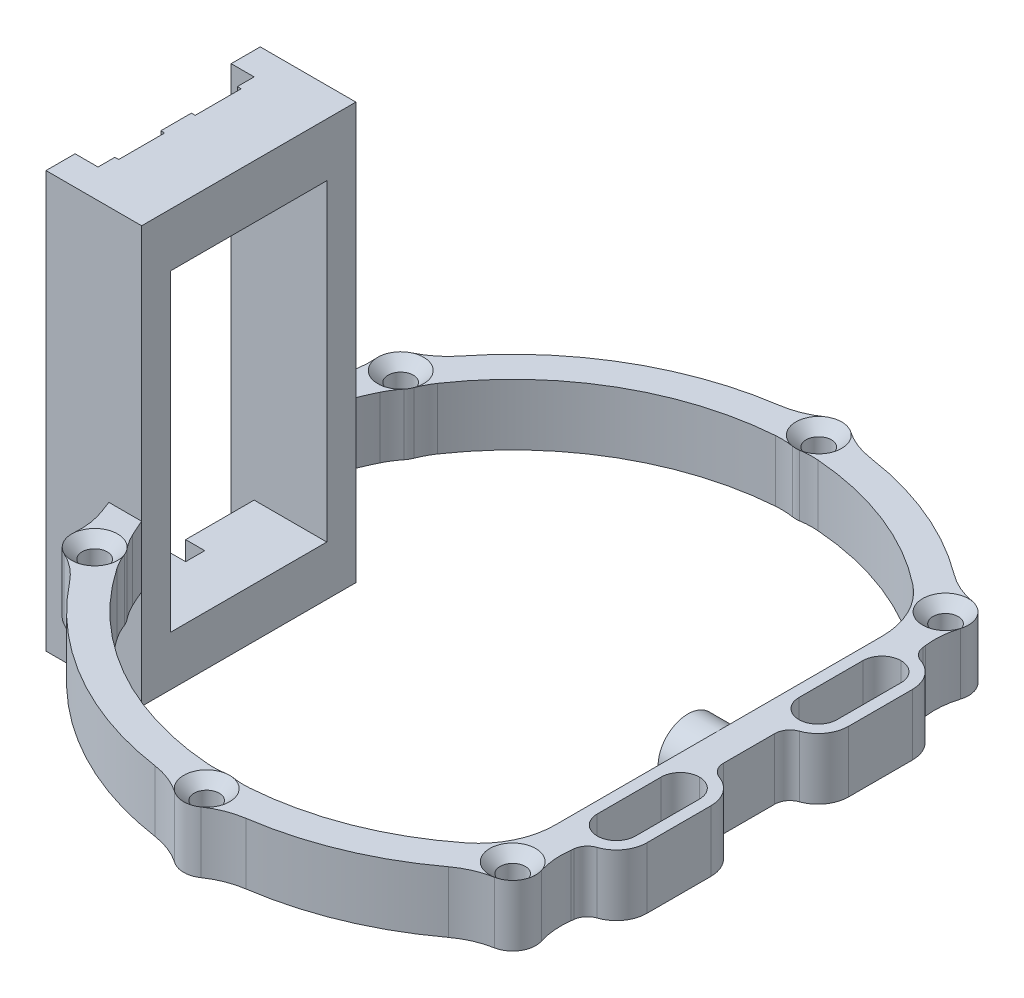
from build123d import *

# Parameters (mm, degrees)
SKETCH6_W                 = 28
SKETCH6_H                 = 54
SKETCH6_R                 = 2.125
SKETCH6_W_2               = 20.4
SKETCH6_H_2               = 40.4
BOSS_EXTRUDE1_DEPTH       = 4
SKETCH7_W                 = 28
SKETCH7_H                 = 54
SKETCH7_W_2               = 20.4
SKETCH7_H_2               = 40.9
BOSS_EXTRUDE2_DEPTH       = 5.5
SKETCH8_W                 = 3.8
SKETCH8_H                 = 6.8
BOSS_EXTRUDE3_DEPTH       = 3
CUT_EXTRUDE1_DEPTH        = 41.912253666
CUT_EXTRUDE1_DEPTH_BACK   = 0.5
SKETCH12_W                = 2.5
SKETCH12_H                = 53.4
CUT_EXTRUDE2_DEPTH        = 2.5
BOSS_EXTRUDE5_DEPTH       = 4
BOSS_EXTRUDE5_DEPTH_BACK  = 4
SKETCH13_R                = 41.232378382
SKETCH13_R_2              = 37.232378382
BOSS_EXTRUDE6_DEPTH       = 0.2
BOSS_EXTRUDE7_DEPTH       = 0.2
BOSS_EXTRUDE8_DEPTH       = 4
BOSS_EXTRUDE8_DEPTH_BACK  = 4
SKETCH17_R                = 3.9
BOSS_EXTRUDE9_DEPTH       = 4
SKETCH18_W                = 48.076230271
SKETCH18_H                = 104.436782707
CUT_EXTRUDE3_DEPTH        = 71.908472886
FILLET1_R                 = 10
FILLET2_R                 = 14
SKETCH19_W                = 20.4
SKETCH19_H                = 40.9
CUT_EXTRUDE4_DEPTH        = 86.905596599
BOSS_EXTRUDE10_DEPTH      = 4
BOSS_EXTRUDE10_DEPTH_BACK = 4
SKETCH20_R                = 3
SKETCH20_R_2              = 1.65
CUT_EXTRUDE5_DEPTH        = 72.950694924
CUT_EXTRUDE5_DEPTH_BACK   = 72.950694924
FILLET5_R                 = 10
CHAMFER1_SIZE             = 1.35
SKETCH22_W                = 4
SKETCH22_H                = 16.35397931
BOSS_EXTRUDE11_DEPTH      = 8
SKETCH23_W                = 5
SKETCH23_H                = 13.35397931
CUT_EXTRUDE6_DEPTH        = 10
FILLET6_R                 = 2.5
FILLET7_R                 = 4
FILLET8_R                 = 2


with BuildPart() as part:
    # Sketch6 → Boss-Extrude1 (new body)
    with BuildSketch(Plane(origin=(-44, 0, 0), x_dir=(0, 0, -1), z_dir=(1, 0, 0))):
        with Locations((0, 10.25)):
            Rectangle(SKETCH6_W, SKETCH6_H)
        with Locations((-5, 34.25)):
            Circle(SKETCH6_R, mode=Mode.SUBTRACT)
        with Locations((5, 34.25)):
            Circle(SKETCH6_R, mode=Mode.SUBTRACT)
        with Locations((-5, -13.75)):
            Circle(SKETCH6_R, mode=Mode.SUBTRACT)
        with Locations((5, -13.75)):
            Circle(SKETCH6_R, mode=Mode.SUBTRACT)
        with Locations((0, 10.25)):
            Rectangle(SKETCH6_W_2, SKETCH6_H_2, mode=Mode.SUBTRACT)
    extrude(amount=BOSS_EXTRUDE1_DEPTH)

    # Sketch7 → Boss-Extrude2 (add)
    with BuildSketch(Plane(origin=(-40, 0, 0), x_dir=(0, 0, -1), z_dir=(1, 0, 0))):
        with Locations((0, 10.25)):
            Rectangle(SKETCH7_W, SKETCH7_H)
        with Locations((0, 10)):
            Rectangle(SKETCH7_W_2, SKETCH7_H_2, mode=Mode.SUBTRACT)
    extrude(amount=BOSS_EXTRUDE2_DEPTH)

    # Sketch8 → Boss-Extrude3 (add)
    with BuildSketch(Plane.ZY.offset(44)):
        with Locations((12.1, 33.85)):
            Rectangle(SKETCH8_W, SKETCH8_H)
        Polygon((14, 30.45), (10.2, 30.45), (10.2, -9.95), (10.2, -16.75), (14, -16.75), align=None)
        Polygon((-10.2, 37.25), (-14, 37.25), (-14, -9.95), (-10.2, -9.95), (-10.2, 30.45), align=None)
        with Locations((-12.1, -13.35)):
            Rectangle(SKETCH8_W, SKETCH8_H)
    extrude(amount=BOSS_EXTRUDE3_DEPTH)

    # Sketch9 → Cut-Extrude1 (cut, two sides: drawn at the far end of the back side and taken through both)
    with BuildSketch(Plane.ZY.offset(44).offset(-CUT_EXTRUDE1_DEPTH_BACK)):
        with BuildLine():
            Line((8, -16.75), (8, -13.75))
            ThreePointArc((8, -13.75), (7.121320344, -15.871320344), (5, -16.75))
            Line((5, -16.75), (8, -16.75))
        make_face()
        with BuildLine():
            ThreePointArc((8, -13.75), (5, -10.75), (2, -13.75))
            Line((2, -13.75), (8, -13.75))
        make_face()
        with BuildLine():
            Line((8, -13.75), (2, -13.75))
            ThreePointArc((2, -13.75), (2.878679656, -15.871320344), (5, -16.75))
            ThreePointArc((5, -16.75), (7.121320344, -15.871320344), (8, -13.75))
        make_face()
        with BuildLine():
            ThreePointArc((5, -16.75), (2.878679656, -15.871320344), (2, -13.75))
            Line((2, -13.75), (2, -16.75))
            Line((2, -16.75), (5, -16.75))
        make_face()
        with BuildLine():
            Line((-2, -16.75), (-2, -13.75))
            ThreePointArc((-2, -13.75), (-2.878679656, -15.871320344), (-5, -16.75))
            Line((-5, -16.75), (-2, -16.75))
        make_face()
        with BuildLine():
            ThreePointArc((-2, -13.75), (-5, -10.75), (-8, -13.75))
            Line((-8, -13.75), (-2, -13.75))
        make_face()
        with BuildLine():
            Line((-2, -13.75), (-8, -13.75))
            ThreePointArc((-8, -13.75), (-7.121320344, -15.871320344), (-5, -16.75))
            ThreePointArc((-5, -16.75), (-2.878679656, -15.871320344), (-2, -13.75))
        make_face()
        with BuildLine():
            ThreePointArc((-5, -16.75), (-7.121320344, -15.871320344), (-8, -13.75))
            Line((-8, -13.75), (-8, -16.75))
            Line((-8, -16.75), (-5, -16.75))
        make_face()
        with BuildLine():
            ThreePointArc((-7.125, 34.25), (-5, 36.375), (-2.875, 34.25))
            Line((-2.875, 34.25), (-2, 34.25))
            ThreePointArc((-2, 34.25), (-2.878679652, 36.371320339), (-4.999999988, 37.25))
            ThreePointArc((-4.999999988, 37.25), (-7.121320339, 36.371320348), (-8, 34.25))
            Line((-8, 34.25), (-7.125, 34.25))
        make_face()
        with BuildLine():
            Line((-2, 34.25), (-2.875, 34.25))
            ThreePointArc((-2.875, 34.25), (-5, 32.125), (-7.125, 34.25))
            Line((-7.125, 34.25), (-8, 34.25))
            ThreePointArc((-8, 34.25), (-5, 31.25), (-2, 34.25))
        make_face()
        with BuildLine():
            ThreePointArc((-7.125, 34.25), (-5, 32.125), (-2.875, 34.25))
            Line((-2.875, 34.25), (-7.125, 34.25))
        make_face()
        with BuildLine():
            Line((-7.125, 34.25), (-2.875, 34.25))
            ThreePointArc((-2.875, 34.25), (-5, 36.375), (-7.125, 34.25))
        make_face()
        with BuildLine():
            ThreePointArc((-4.999999988, 37.25), (-2.878679652, 36.371320339), (-2, 34.25))
            Line((-2, 34.25), (-2, 37.25))
            Line((-2, 37.25), (-4.999999988, 37.25))
        make_face()
        with BuildLine():
            Line((-8, 37.25), (-8, 34.25))
            ThreePointArc((-8, 34.25), (-7.121320339, 36.371320348), (-4.999999988, 37.25))
            Line((-4.999999988, 37.25), (-8, 37.25))
        make_face()
        with BuildLine():
            Line((8, 37.25), (5, 37.25))
            ThreePointArc((5, 37.25), (7.121320344, 36.371320344), (8, 34.25))
            Line((8, 34.25), (8, 37.25))
        make_face()
        with BuildLine():
            ThreePointArc((5, 37.25), (2.878679656, 36.371320344), (2, 34.25))
            Line((2, 34.25), (2.875, 34.25))
            ThreePointArc((2.875, 34.25), (5, 36.375), (7.125, 34.25))
            Line((7.125, 34.25), (8, 34.25))
            ThreePointArc((8, 34.25), (7.121320344, 36.371320344), (5, 37.25))
        make_face()
        with BuildLine():
            Line((2.875, 34.25), (2, 34.25))
            ThreePointArc((2, 34.25), (5, 31.25), (8, 34.25))
            Line((8, 34.25), (7.125, 34.25))
            ThreePointArc((7.125, 34.25), (5, 32.125), (2.875, 34.25))
        make_face()
        with BuildLine():
            Line((5, 37.25), (2, 37.25))
            Line((2, 37.25), (2, 34.25))
            ThreePointArc((2, 34.25), (2.878679656, 36.371320344), (5, 37.25))
        make_face()
        with BuildLine():
            ThreePointArc((7.125, 34.25), (5, 36.375), (2.875, 34.25))
            Line((2.875, 34.25), (7.125, 34.25))
        make_face()
        with BuildLine():
            Line((7.125, 34.25), (2.875, 34.25))
            ThreePointArc((2.875, 34.25), (5, 32.125), (7.125, 34.25))
        make_face()
    extrude(amount=CUT_EXTRUDE1_DEPTH + CUT_EXTRUDE1_DEPTH_BACK, mode=Mode.SUBTRACT)

    # Sketch12 → Cut-Extrude2 (cut)
    with BuildSketch(Plane.ZY.offset(44)):
        with Locations((0, 10.25)):
            Rectangle(SKETCH12_W, SKETCH12_H)
    extrude(amount=-CUT_EXTRUDE2_DEPTH, mode=Mode.SUBTRACT)

    # Sketch13 → Boss-Extrude5 (add, two sides: drawn at the far end of the back side and taken through both)
    with BuildSketch(Plane(origin=(0, 0, 0), x_dir=(1, 0, 0), z_dir=(0, 1, 0)).offset(-BOSS_EXTRUDE5_DEPTH_BACK)):
        Circle(SKETCH13_R)
        Circle(SKETCH13_R_2, mode=Mode.SUBTRACT)
    extrude(amount=BOSS_EXTRUDE5_DEPTH + BOSS_EXTRUDE5_DEPTH_BACK)

    # Sketch14 → Boss-Extrude6 (add)
    with BuildSketch(Plane(origin=(0, 37.25, 0), x_dir=(1, 0, 0), z_dir=(0, 1, 0))):
        Polygon((-44, 2), (-44, -2), (-43.5, -2), (-43.5, -8), (-44, -8), (-44, -10.2), (-47, -10.2), (-47, -14), (-34.5, -14), (-34.5, 14), (-47, 14), (-47, 10.2), (-44, 10.2), (-44, 8), (-43.5, 8), (-43.5, 2), align=None)
    extrude(amount=BOSS_EXTRUDE6_DEPTH)

    # Sketch15 → Boss-Extrude7 (add)
    with BuildSketch(Plane.XZ.offset(16.75)):
        Polygon((-43.5, 2), (-44, 2), (-44, -2), (-43.5, -2), (-43.5, -8), (-44, -8), (-44, -10.2), (-47, -10.2), (-47, -14), (-34.5, -14), (-34.5, 14), (-47, 14), (-47, 10.2), (-44, 10.2), (-44, 8), (-43.5, 8), align=None)
    extrude(amount=BOSS_EXTRUDE7_DEPTH)

    # Sketch16 → Boss-Extrude8 (add, two sides: drawn at the far end of the back side and taken through both)
    with BuildSketch(Plane(origin=(0, 0, 0), x_dir=(1, 0, 0), z_dir=(0, 1, 0)).offset(-BOSS_EXTRUDE8_DEPTH_BACK)):
        with BuildLine():
            ThreePointArc((30.9, 20.771133816), (29.006669365, 23.342303492), (26.9, 25.741794809))
            Line((26.9, 25.741794809), (26.9, -25.741794809))
            ThreePointArc((26.9, -25.741794809), (29.006669365, -23.342303492), (30.9, -20.771133816))
            Line((30.9, -20.771133816), (30.9, 20.771133816))
        make_face()
    extrude(amount=BOSS_EXTRUDE8_DEPTH + BOSS_EXTRUDE8_DEPTH_BACK)

    # Sketch17 → Boss-Extrude9 (add)
    with BuildSketch(Plane.ZY.offset(-26.9)):
        Circle(SKETCH17_R)
    extrude(amount=BOSS_EXTRUDE9_DEPTH)

    # Sketch18 → Cut-Extrude3 (cut, through all)
    with BuildSketch(Plane(origin=(0, 4, 0), x_dir=(1, 0, 0), z_dir=(0, 1, 0))):
        with Locations((54.938115136, -6.824380144)):
            Rectangle(SKETCH18_W, SKETCH18_H)
    extrude(amount=-CUT_EXTRUDE3_DEPTH, mode=Mode.SUBTRACT)

    # Fillet1
    fillet1_edges = [part.edges().sort_by_distance(p)[0] for p in [
        (26.9, 0, -25.741794809),
        (26.9, 0, 25.741794809),
    ]]
    fillet(fillet1_edges, radius=FILLET1_R)

    # Fillet2
    fillet2_edges = [part.edges().sort_by_distance(p)[0] for p in [
        (30.9, 0, -27.30016533),
        (30.9, 0, 27.30016533),
    ]]
    fillet(fillet2_edges, radius=FILLET2_R)

    # Sketch19 → Cut-Extrude4 (cut, through all)
    with BuildSketch(Plane(origin=(-34.5, 0, 0), x_dir=(0, 0, -1), z_dir=(1, 0, 0))):
        with Locations((0, 10)):
            Rectangle(SKETCH19_W, SKETCH19_H)
    extrude(amount=-CUT_EXTRUDE4_DEPTH, mode=Mode.SUBTRACT)

    # Sketch20 → Boss-Extrude10 (add, two sides: drawn at the far end of the back side and taken through both)
    # profile 1 of 6: a face of its own
    with BuildSketch(Plane(origin=(0, 0, 0), x_dir=(1, 0, 0), z_dir=(0, 1, 0)).offset(-BOSS_EXTRUDE10_DEPTH_BACK)):
        with Locations((28.284271247, 28.284271247)):
            Circle(SKETCH20_R)
        with Locations((28.284271247, 28.284271247)):
            Circle(SKETCH20_R_2, mode=Mode.SUBTRACT)
    # profile 2 of 6: a face of its own
    with BuildSketch(Plane(origin=(0, 0, 0), x_dir=(1, 0, 0), z_dir=(0, 1, 0)).offset(-BOSS_EXTRUDE10_DEPTH_BACK)):
        with Locations((28.284271247, -28.284271247)):
            Circle(SKETCH20_R)
        with Locations((28.284271247, -28.284271247)):
            Circle(SKETCH20_R_2, mode=Mode.SUBTRACT)
    # profile 3 of 6: a face of its own
    with BuildSketch(Plane(origin=(0, 0, 0), x_dir=(1, 0, 0), z_dir=(0, 1, 0)).offset(-BOSS_EXTRUDE10_DEPTH_BACK)):
        with Locations((0, -40)):
            Circle(SKETCH20_R)
        with Locations((0, -40)):
            Circle(SKETCH20_R_2, mode=Mode.SUBTRACT)
    # profile 4 of 6: a face of its own
    with BuildSketch(Plane(origin=(0, 0, 0), x_dir=(1, 0, 0), z_dir=(0, 1, 0)).offset(-BOSS_EXTRUDE10_DEPTH_BACK)):
        with Locations((0, 40)):
            Circle(SKETCH20_R)
        with Locations((0, 40)):
            Circle(SKETCH20_R_2, mode=Mode.SUBTRACT)
    # profile 5 of 6: a face of its own
    with BuildSketch(Plane(origin=(0, 0, 0), x_dir=(1, 0, 0), z_dir=(0, 1, 0)).offset(-BOSS_EXTRUDE10_DEPTH_BACK)):
        with Locations((-34.641016151, 20)):
            Circle(SKETCH20_R)
        with Locations((-34.641016151, 20)):
            Circle(SKETCH20_R_2, mode=Mode.SUBTRACT)
    # profile 6 of 6: a face of its own
    with BuildSketch(Plane(origin=(0, 0, 0), x_dir=(1, 0, 0), z_dir=(0, 1, 0)).offset(-BOSS_EXTRUDE10_DEPTH_BACK)):
        with Locations((-34.641016151, -20)):
            Circle(SKETCH20_R)
        with Locations((-34.641016151, -20)):
            Circle(SKETCH20_R_2, mode=Mode.SUBTRACT)
    extrude(amount=BOSS_EXTRUDE10_DEPTH + BOSS_EXTRUDE10_DEPTH_BACK)

    # Sketch21 → Cut-Extrude5 (cut, two sides: drawn at the far end of the back side and taken through both)
    with BuildSketch(Plane(origin=(0, 4, 0), x_dir=(1, 0, 0), z_dir=(0, 1, 0)).offset(-CUT_EXTRUDE5_DEPTH_BACK)):
        with BuildLine():
            ThreePointArc((-1.113823956, 41.217331588), (-0.665090397, 38.489981867), (1.65, 40))
            ThreePointArc((1.65, 40), (1.510018133, 40.665090397), (1.113823956, 41.217331588))
            ThreePointArc((1.113823956, 41.217331588), (0, 41.232378382), (-1.113823956, 41.217331588))
        make_face()
        with BuildLine():
            ThreePointArc((-1.113823956, 41.217331588), (0, 41.232378382), (1.113823956, 41.217331588))
            ThreePointArc((1.113823956, 41.217331588), (0, 41.65), (-1.113823956, 41.217331588))
        make_face()
        with BuildLine():
            ThreePointArc((29.587521583, 27.272323342), (29.845178524, 27.749417554), (29.934271247, 28.284271247))
            ThreePointArc((29.934271247, 28.284271247), (29.339440646, 29.552781216), (27.983825745, 29.906686885))
            ThreePointArc((27.983825745, 29.906686885), (28.858436614, 28.633800306), (29.587521583, 27.272323342))
        make_face()
        with BuildLine():
            ThreePointArc((29.587521583, 27.272323342), (28.858436614, 28.633800306), (27.983825745, 29.906686885))
            ThreePointArc((27.983825745, 29.906686885), (26.874884075, 27.426292344), (29.587521583, 27.272323342))
        make_face()
        with BuildLine():
            ThreePointArc((27.983825745, -29.906686885), (29.339440646, -29.552781216), (29.934271247, -28.284271247))
            ThreePointArc((29.934271247, -28.284271247), (29.845178524, -27.749417554), (29.587521583, -27.272323342))
            ThreePointArc((29.587521583, -27.272323342), (28.858436614, -28.633800306), (27.983825745, -29.906686885))
        make_face()
        with BuildLine():
            ThreePointArc((27.983825745, -29.906686885), (28.858436614, -28.633800306), (29.587521583, -27.272323342))
            ThreePointArc((29.587521583, -27.272323342), (26.874884075, -27.426292344), (27.983825745, -29.906686885))
        make_face()
        with BuildLine():
            ThreePointArc((1.113823956, -41.217331588), (1.510018133, -40.665090397), (1.65, -40))
            ThreePointArc((1.65, -40), (-0.665090397, -38.489981867), (-1.113823956, -41.217331588))
            ThreePointArc((-1.113823956, -41.217331588), (0, -41.232378382), (1.113823956, -41.217331588))
        make_face()
        with BuildLine():
            ThreePointArc((1.113823956, -41.217331588), (0, -41.232378382), (-1.113823956, -41.217331588))
            ThreePointArc((-1.113823956, -41.217331588), (0, -41.65), (1.113823956, -41.217331588))
        make_face()
        with BuildLine():
            ThreePointArc((-35.138344254, -21.573265635), (-33.665847286, -21.330994247), (-32.991016151, -20))
            ThreePointArc((-32.991016151, -20), (-34.461992264, -18.359740738), (-36.252168209, -19.644065953))
            ThreePointArc((-36.252168209, -19.644065953), (-35.708287137, -20.616189191), (-35.138344254, -21.573265635))
        make_face()
        with BuildLine():
            ThreePointArc((-35.138344254, -21.573265635), (-35.708287137, -20.616189191), (-36.252168209, -19.644065953))
            ThreePointArc((-36.252168209, -19.644065953), (-36.069958068, -20.825), (-35.138344254, -21.573265635))
        make_face()
        with BuildLine():
            ThreePointArc((-36.252168209, 19.644065953), (-34.461992264, 18.359740738), (-32.991016151, 20))
            ThreePointArc((-32.991016151, 20), (-33.665847286, 21.330994247), (-35.138344254, 21.573265635))
            ThreePointArc((-35.138344254, 21.573265635), (-35.708287137, 20.616189191), (-36.252168209, 19.644065953))
        make_face()
        with BuildLine():
            ThreePointArc((-36.252168209, 19.644065953), (-35.708287137, 20.616189191), (-35.138344254, 21.573265635))
            ThreePointArc((-35.138344254, 21.573265635), (-36.069958068, 20.825), (-36.252168209, 19.644065953))
        make_face()
    extrude(amount=CUT_EXTRUDE5_DEPTH + CUT_EXTRUDE5_DEPTH_BACK, mode=Mode.SUBTRACT)

    # Fillet5
    fillet5_edges = [part.edges().sort_by_distance(p)[0] for p in [
        (-1.116806097, 0, -37.215625),
        (1.116806097, 0, -37.215625),
        (1.116806097, 0, 37.215625),
        (-1.116806097, 0, 37.215625),
        (-32.788079716, 0, -17.640630048),
        (-31.671273619, 0, -19.574994952),
        (-31.671273619, 0, 19.574994952),
        (-32.788079716, 0, 17.640630048),
        (27.035295347, 0, -31.011918439),
        (30.133729568, 0, -25.922173891),
        (-2.775426352, 0, -41.138862838),
        (2.775426352, 0, -41.138862838),
        (-37.015013477, 0, -18.165841692),
        (-34.239587125, 0, -22.973021146),
        (-34.239587125, 0, 22.973021146),
        (-37.015013477, 0, 18.165841692),
        (2.775426352, 0, 41.138862838),
        (-2.775426352, 0, 41.138862838),
        (30.133729568, 0, 25.922173891),
        (27.035295347, 0, 31.011918439),
    ]]
    fillet(fillet5_edges, radius=FILLET5_R)

    # Chamfer1
    chamfer1_edges = [part.edges().sort_by_distance(p)[0] for p in [
        (28.58471675, 4, -26.66185561),
        (26.981020912, 4, 29.296219153),
        (-1.113823956, 4, 38.782668412),
        (-1.65, 4, -40),
        (-33.029864093, 4, -20.355934047),
        (-34.143688049, 4, 18.426734365),
    ]]
    chamfer(chamfer1_edges, length=CHAMFER1_SIZE - 0.0001)  # a hair under: the kernel refuses the full size

    # Sketch22 → Boss-Extrude11 (add)
    with BuildSketch(Plane(origin=(0, 4, 0), x_dir=(1, 0, 0), z_dir=(0, 1, 0))):
        with Locations((32.9, 13.176989655)):
            Rectangle(SKETCH22_W, SKETCH22_H)
        with Locations((32.9, -13.176989655)):
            Rectangle(SKETCH22_W, SKETCH22_H)
    extrude(amount=-BOSS_EXTRUDE11_DEPTH)

    # Sketch23 → Cut-Extrude6 (cut)
    with BuildSketch(Plane(origin=(0, 4, 0), x_dir=(1, 0, 0), z_dir=(0, 1, 0))):
        with Locations((30.9, 13.176989655)):
            Rectangle(SKETCH23_W, SKETCH23_H)
        with Locations((30.9, -13.176989655)):
            Rectangle(SKETCH23_W, SKETCH23_H)
    extrude(amount=-CUT_EXTRUDE6_DEPTH, mode=Mode.SUBTRACT)

    # Fillet6
    fillet6_edges = [part.edges().sort_by_distance(p)[0] for p in [
        (28.4, 0, 19.85397931),
        (33.4, 0, 19.85397931),
        (33.4, 0, 6.5),
        (28.4, 0, 6.5),
        (28.4, 0, -6.5),
        (33.4, 0, -6.5),
        (33.4, 0, -19.85397931),
        (28.4, 0, -19.85397931),
    ]]
    fillet(fillet6_edges, radius=FILLET6_R - 0.0001)  # a hair under: the kernel refuses the full size

    # Fillet7
    fillet7_edges = [part.edges().sort_by_distance(p)[0] for p in [
        (34.9, 0, 21.35397931),
        (34.9, 0, 5),
        (34.9, 0, -21.35397931),
        (34.9, 0, -5),
    ]]
    fillet(fillet7_edges, radius=FILLET7_R - 0.0001)  # a hair under: the kernel refuses the full size

    # Fillet8
    fillet8_edges = [part.edges().sort_by_distance(p)[0] for p in [
        (30.9, 0, -5),
        (30.9, 0, 5),
        (30.9, 0, -21.35397931),
        (30.9, 0, 21.35397931),
    ]]
    fillet(fillet8_edges, radius=FILLET8_R)


solid = part.part
